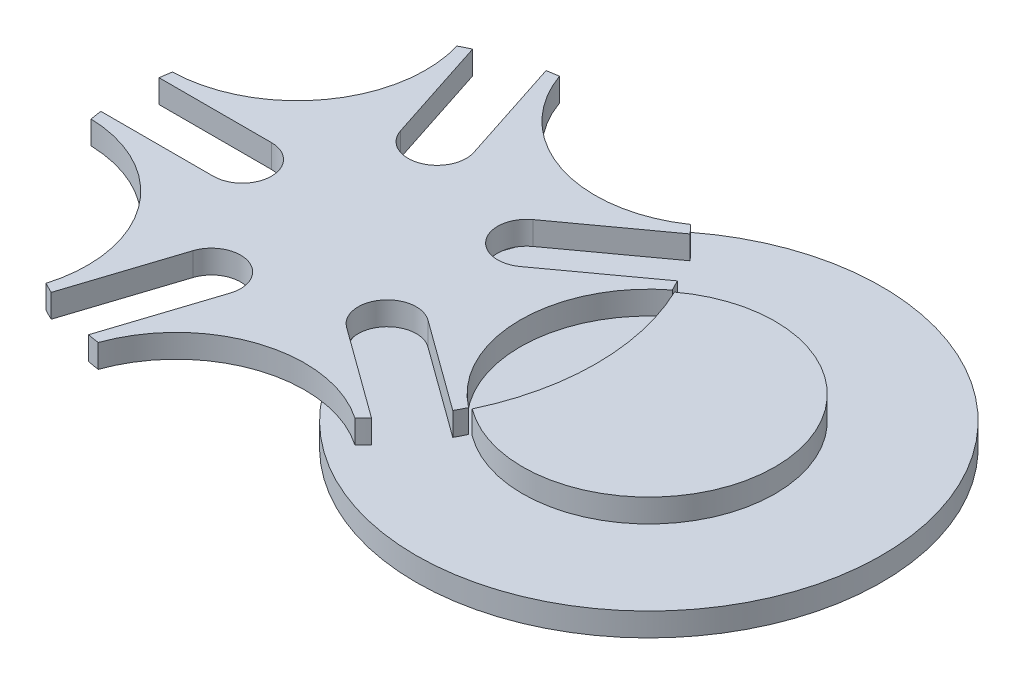
from build123d import *

# Parameters (mm, degrees)
DRIVEWHEEL_TOP_DEPTH    = 2.54
MAIN_CIRCLES_R          = 25.4
BOSS_EXTRUDE4_DEPTH     = 2.54
CUT_EXTRUDE4_DEPTH      = 2.54
CUT_EXTRUDE4_DEPTH_BACK = 5.08
CUT_EXTRUDE6_DEPTH      = 5.08
CUT_EXTRUDE6_DEPTH_BACK = 5.08
SKETCH13_R              = 25.4
SKETCH13_R_2            = 3.175
BOSS_EXTRUDE5_DEPTH     = 2.54


with BuildPart() as part:
    # Sketch8 → drivewheel top (new body)
    with BuildSketch(Plane(origin=(0, 0, 0), x_dir=(1, 0, 0), z_dir=(0, 1, 0))):
        with BuildLine():
            ThreePointArc((23.160246188, 11.033164211), (25.654, 0), (23.160246188, -11.033164211))
            ThreePointArc((23.160246188, -11.033164211), (45.1642216, 0), (23.160246188, 11.033164211))
        make_face()
    extrude(amount=DRIVEWHEEL_TOP_DEPTH)


with BuildPart() as body_2:
    # main circles → Boss-Extrude4 (new body)
    with BuildSketch(Plane(origin=(0, 0, 0), x_dir=(1, 0, 0), z_dir=(0, 1, 0))):
        Circle(MAIN_CIRCLES_R)
    extrude(amount=BOSS_EXTRUDE4_DEPTH)

    # 5 slots → Cut-Extrude4 (cut, two sides: drawn at the far end of the back side and taken through both)
    with BuildSketch(Plane(origin=(0, 0, 0), x_dir=(1, 0, 0), z_dir=(0, 1, 0)).offset(-CUT_EXTRUDE4_DEPTH_BACK)):
        with BuildLine():
            Line((18.682813481, 17.498374365), (8.604036416, 10.175714197))
            ThreePointArc((8.604036416, 10.175714197), (7.901625635, 5.740867064), (12.336472768, 5.038456283))
            Line((12.336472768, 5.038456283), (22.415249833, 12.361116451))
            ThreePointArc((22.415249833, 12.361116451), (23.117660614, 16.795963584), (18.682813481, 17.498374365))
        make_face()
        with BuildLine():
            Line((18.682813481, -17.498374365), (8.604036416, -10.175714197))
            ThreePointArc((8.604036416, -10.175714197), (7.901625635, -5.740867064), (12.336472768, -5.038456283))
            Line((12.336472768, -5.038456283), (22.415249833, -12.361116451))
            ThreePointArc((22.415249833, -12.361116451), (23.117660614, -16.795963584), (18.682813481, -17.498374365))
        make_face()
        with BuildLine():
            Line((-10.868636096, -23.175706557), (-7.018885822, -11.327393516))
            ThreePointArc((-7.018885822, -11.327393516), (-3.018152426, -9.288918034), (-0.979676944, -13.289651431))
            Line((-0.979676944, -13.289651431), (-4.829427218, -25.137964471))
            ThreePointArc((-4.829427218, -25.137964471), (-8.830160614, -27.176439953), (-10.868636096, -23.175706557))
        make_face()
        with BuildLine():
            Line((-25.4, 3.175), (-12.941946417, 3.175))
            ThreePointArc((-12.941946417, 3.175), (-9.766946417, 0), (-12.941946417, -3.175))
            Line((-12.941946417, -3.175), (-25.4, -3.175))
            ThreePointArc((-25.4, -3.175), (-28.575, 0), (-25.4, 3.175))
        make_face()
        with BuildLine():
            Line((-4.829427218, 25.137964471), (-0.979676944, 13.289651431))
            ThreePointArc((-0.979676944, 13.289651431), (-3.018152426, 9.288918034), (-7.018885822, 11.327393516))
            Line((-7.018885822, 11.327393516), (-10.868636096, 23.175706557))
            ThreePointArc((-10.868636096, 23.175706557), (-8.830160614, 27.176439953), (-4.829427218, 25.137964471))
        make_face()
    extrude(amount=CUT_EXTRUDE4_DEPTH + CUT_EXTRUDE4_DEPTH_BACK, mode=Mode.SUBTRACT)

    # divots → Cut-Extrude6 (cut, two sides: drawn at the far end of the back side and taken through both)
    with BuildSketch(Plane(origin=(0, 0, 0), x_dir=(1, 0, 0), z_dir=(0, 1, 0)).offset(-CUT_EXTRUDE6_DEPTH_BACK)):
        with BuildLine():
            ThreePointArc((22.84131474, -11.110100852), (25.4, 0), (22.84131474, 11.110100852))
            ThreePointArc((22.84131474, 11.110100852), (17.374031657, 0), (22.84131474, -11.110100852))
        make_face()
        with BuildLine():
            ThreePointArc((-3.507979383, 25.156591197), (5.368871043, 16.523686022), (17.624688241, 18.290171252))
            ThreePointArc((17.624688241, 18.290171252), (7.849031657, 24.156835514), (-3.507979383, 25.156591197))
        make_face()
        with BuildLine():
            ThreePointArc((-3.507979383, -25.156591197), (7.849031657, -24.156835514), (17.624688241, -18.290171252))
            ThreePointArc((17.624688241, -18.290171252), (5.368871043, -16.523686022), (-3.507979383, -25.156591197))
        make_face()
        with BuildLine():
            ThreePointArc((-25.009365231, 4.437527549), (-14.055886871, 10.212199581), (-11.948658366, 22.414048346))
            ThreePointArc((-11.948658366, 22.414048346), (-20.549031657, 14.929745408), (-25.009365231, 4.437527549))
        make_face()
        with BuildLine():
            ThreePointArc((-25.009365231, -4.437527549), (-20.549031657, -14.929745408), (-11.948658366, -22.414048346))
            ThreePointArc((-11.948658366, -22.414048346), (-14.055886871, -10.212199581), (-25.009365231, -4.437527549))
        make_face()
    extrude(amount=CUT_EXTRUDE6_DEPTH + CUT_EXTRUDE6_DEPTH_BACK, mode=Mode.SUBTRACT)


with BuildPart() as body_3:
    # Sketch13 → Boss-Extrude5 (new body)
    with BuildSketch(Plane(origin=(0, 0, 0), x_dir=(1, 0, 0), z_dir=(0, 1, 0))):
        with Locations((31.396126628, 0)):
            Circle(SKETCH13_R)
        with Locations((12.941946417, 0)):
            Circle(SKETCH13_R_2, mode=Mode.SUBTRACT)
    extrude(amount=-BOSS_EXTRUDE5_DEPTH)


solid = Compound([part.part, body_2.part, body_3.part])
